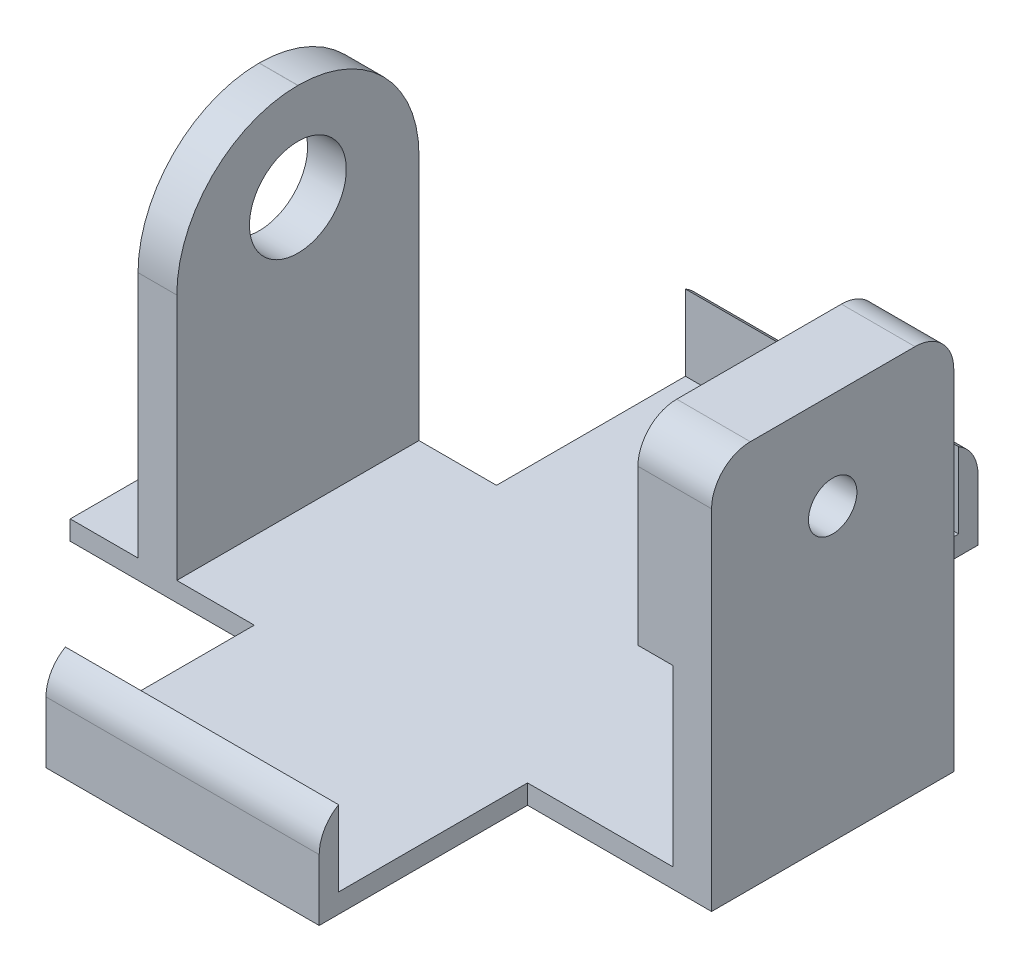
from build123d import *

# Parameters (mm, degrees)
BOSS_EXTRUDE1_DEPTH  = 2
SKETCH2_W            = 28.2
SKETCH2_H            = 9.8
BOSS_EXTRUDE2_DEPTH  = 2
FILLET1_R            = 4
FILLET1_OF_MIRROR2_R = 4
SKETCH3_W            = 25
SKETCH3_H            = 40
SKETCH3_R            = 2.5
BOSS_EXTRUDE3_DEPTH  = 7.6
FILLET2_R            = 4
CUT_EXTRUDE1_REACH   = 71.698
SKETCH4_W            = 3.6
SKETCH4_H            = 18
SKETCH5_R            = 5
BOSS_EXTRUDE4_DEPTH  = 4


with BuildPart() as part:
    # Sketch1 → Boss-Extrude1 (new body)
    with BuildSketch(Plane(origin=(0, 0, 0), x_dir=(1, 0, 0), z_dir=(0, 1, 0))):
        Polygon((-14.1, 12.5), (-14.1, 34), (14.1, 34), (14.1, 12.5), (33.1, 12.5), (33.1, -12.5), (14.1, -12.5), (14.1, -34), (-14.1, -34), (-14.1, -12.5), (-33.1, -12.5), (-33.1, 12.5), align=None)
    boss_extrude1 = extrude(amount=BOSS_EXTRUDE1_DEPTH)

    # Sketch2 → Boss-Extrude2 (add)
    with BuildSketch(Plane.XY.offset(34)):
        with Locations((0, 4.9)):
            Rectangle(SKETCH2_W, SKETCH2_H)
    boss_extrude2 = extrude(amount=-BOSS_EXTRUDE2_DEPTH)

    # Fillet1
    # the kernel refuses this fillet: 4 mm, written as the material it takes off along each edge
    with BuildSketch(Plane(origin=(-22.760254038, 9.8, 34), x_dir=(0, -1, 0), z_dir=(1, 0, 0))) as fillet1_piece_1:
        with BuildLine():
            CenterArc((3.464101615, 4), FILLET1_R, 210, 60)
            Line((0, 2), (-0.069282032, 1.96))
            ThreePointArc((-0.069282032, 1.96), (-0.08, 1), (-0.08, 0))
            Line((-0.08, 0), (0, -0.08))
            Line((0, -0.08), (3.464101615, -0.08))
            Line((3.464101615, -0.08), (3.464101615, 0))
        make_face()
    extrude(amount=45.520508076, mode=Mode.SUBTRACT)

    # Mirror2: Boss-Extrude1, Boss-Extrude2 across plane
    add(boss_extrude1.mirror(Plane.XY))
    add(boss_extrude2.mirror(Plane.XY))

    # Fillet1 of Mirror2
    # the kernel refuses this fillet: 4 mm, written as the material it takes off along each edge
    with BuildSketch(Plane(origin=(-22.760254038, 9.8, -34), x_dir=(0, -1, 0), z_dir=(1, 0, 0))) as fillet1_of_mirror2_piece_1:
        with BuildLine():
            CenterArc((3.464101615, -4), FILLET1_OF_MIRROR2_R, 90, 60)
            Line((0, -2), (-0.069282032, -1.96))
            ThreePointArc((-0.069282032, -1.96), (-0.08, -1), (-0.08, 0))
            Line((-0.08, 0), (0, 0.08))
            Line((0, 0.08), (3.464101615, 0.08))
            Line((3.464101615, 0.08), (3.464101615, 0))
        make_face()
    extrude(amount=45.520508076, mode=Mode.SUBTRACT)

    # Sketch3 → Boss-Extrude3 (add)
    with BuildSketch(Plane(origin=(33.1, 0, 0), x_dir=(0, 0, -1), z_dir=(1, 0, 0))):
        with Locations((0, 20)):
            Rectangle(SKETCH3_W, SKETCH3_H)
        with Locations((0, 30)):
            Circle(SKETCH3_R, mode=Mode.SUBTRACT)
    extrude(amount=-BOSS_EXTRUDE3_DEPTH)

    # Fillet2
    fillet2_edges = [part.edges().sort_by_distance(p)[0] for p in [
        (29.3, 40, -12.5),
        (29.3, 40, 12.5),
    ]]
    fillet(fillet2_edges, radius=FILLET2_R)

    # Sketch4 → Cut-Extrude1 (cut, up to next)
    with BuildSketch(Plane.XY.offset(12.5), mode=Mode.PRIVATE) as cut_extrude1_sk1:
        with Locations((27.3, 11)):
            Rectangle(SKETCH4_W, SKETCH4_H)
    cut_extrude1_tool1 = extrude(cut_extrude1_sk1.sketch, amount=-CUT_EXTRUDE1_REACH, mode=Mode.PRIVATE) & part.part
    add(cut_extrude1_tool1.solids().sort_by_distance((27.3, 11, 12.5))[0], mode=Mode.SUBTRACT)

    # Sketch5 → Boss-Extrude4 (add)
    with BuildSketch(Plane.ZY.offset(26.1)):
        with BuildLine():
            Line((12.5, 0), (-12.5, 0))
            Line((-12.5, 0), (-12.5, 27.51))
            ThreePointArc((-12.5, 27.51), (-8.841763697, 36.341763697), (-0.01, 40))
            Line((-0.01, 40), (0.01, 40))
            ThreePointArc((0.01, 40), (8.841763697, 36.341763697), (12.5, 27.51))
            Line((12.5, 27.51), (12.5, 0))
        make_face()
        with Locations((0, 30)):
            Circle(SKETCH5_R, mode=Mode.SUBTRACT)
    extrude(amount=-BOSS_EXTRUDE4_DEPTH)


solid = part.part
